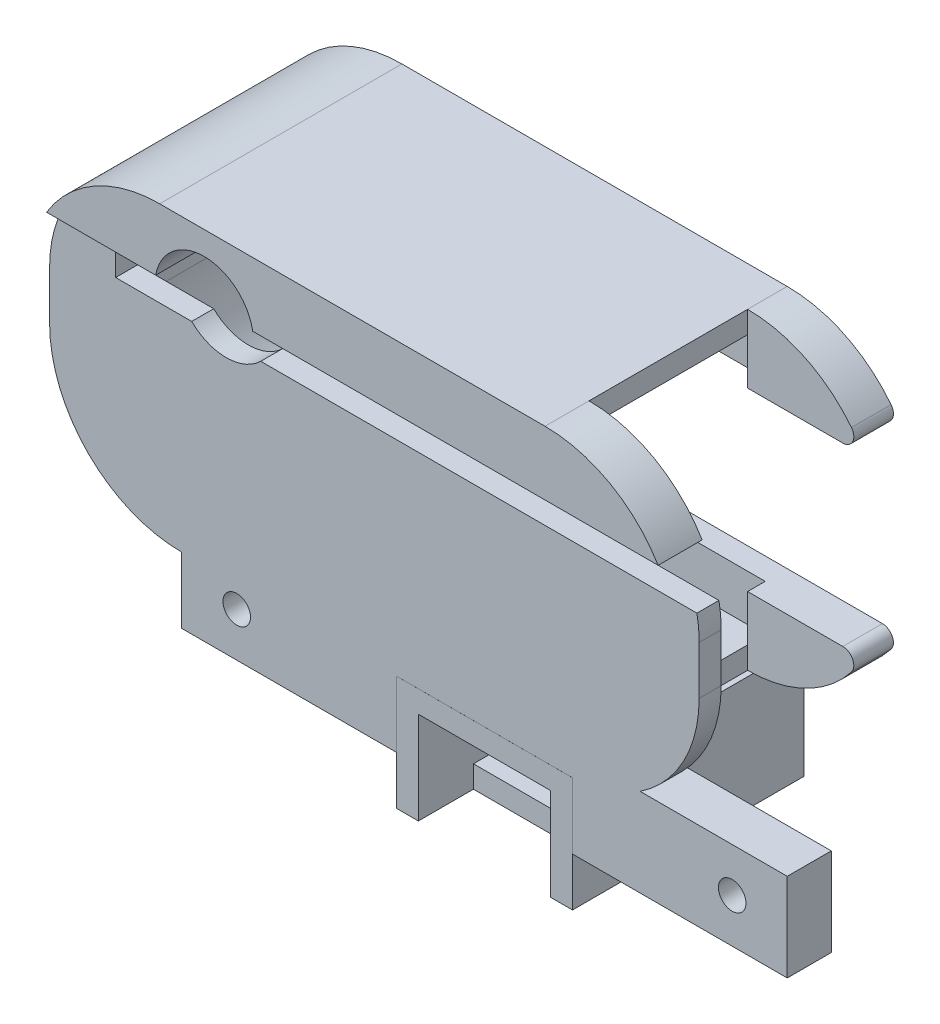
from build123d import *

# Parameters (mm, degrees)
BOSS_EXTRUDE1_OUTLINE_W  = 69.85
BOSS_EXTRUDE1_OUTLINE_H  = 10.16
BOSS_EXTRUDE1_DEPTH      = 5.08
SKETCH2_W                = 74.93
SKETCH2_H                = 36.068
BOSS_EXTRUDE2_DEPTH      = 25.4
FILLET1_R                = 15.24
SHELL5_START             = -17.78
SHELL5_DEPTH             = 20.32
SKETCH8_W                = 5.08
SKETCH8_H                = 20.32
CUT_EXTRUDE1_DEPTH       = 39.37
FILLET2_R                = 2.54
FILLET3_R                = 1.27
BOSS_EXTRUDE4_DEPTH      = 0.00254
BOSS_EXTRUDE4_DEPTH_BACK = 26.67
SKETCH4_W                = 20.32
SKETCH4_H                = 13.208
SKETCH9_R                = 3.175
CUT_EXTRUDE2_DEPTH       = 87.597276135
SKETCH10_R               = 5.690074484
CUT_EXTRUDE3_DEPTH       = 6.35
SKETCH11_R               = 1.5875
CUT_EXTRUDE4_DEPTH       = 7.62
SKETCH12_W               = 76.2
SKETCH12_H               = 5.08
CUT_EXTRUDE5_DEPTH       = 2.54
BOSS_EXTRUDE5_DEPTH      = 2.032
SKETCH14_W               = 15.24
SKETCH14_H               = 6.35
CUT_EXTRUDE6_DEPTH       = 2.54
SKETCH16_W               = 15.24
SKETCH16_H               = 8.128
CUT_EXTRUDE8_DEPTH       = 25.4
BOSS_EXTRUDE6_DEPTH      = 2.54


# Read off the part's stored shape, not the designer's step: Boss-Extrude1, Shell5
with BuildPart() as part:
    # Boss-Extrude1 outline → Boss-Extrude1 (new body)
    with BuildSketch(Plane.XY):
        with Locations((34.925, 5.08)):
            Rectangle(BOSS_EXTRUDE1_OUTLINE_W, BOSS_EXTRUDE1_OUTLINE_H)
    extrude(amount=BOSS_EXTRUDE1_DEPTH)

    # Sketch2 → Boss-Extrude2 (add)
    with BuildSketch(Plane.XY.offset(5.08)):
        with Locations((22.225, 25.654)):
            Rectangle(SKETCH2_W, SKETCH2_H)
    extrude(amount=-BOSS_EXTRUDE2_DEPTH)

    # Fillet1
    fillet1_edges = [part.edges().sort_by_distance(p)[0] for p in [
        (59.69, 7.62, -10.16),
        (59.69, 43.688, -7.62),
        (-15.24, 7.62, -7.62),
        (-15.24, 43.688, -7.62),
    ]]
    fillet(fillet1_edges, radius=FILLET1_R)

    # Shell5 outline → Shell5 (cut)
    with BuildSketch(Plane.XY.offset(SHELL5_START)):
        with BuildLine():
            ThreePointArc((-12.7, 22.86), (-8.980256121, 13.879743879), (0, 10.16))
            Line((0, 10.16), (44.45, 10.16))
            Line((44.45, 10.16), (44.45, 7.62))
            ThreePointArc((44.45, 7.62), (48.849409051, 8.268810878), (52.874226968, 10.16))
            ThreePointArc((52.874226968, 10.16), (57.878380747, 15.6533232), (59.69, 22.86))
            Line((59.69, 22.86), (59.69, 28.448))
            ThreePointArc((59.69, 28.448), (55.226307345, 39.224307345), (44.45, 43.688))
            Line((44.45, 43.688), (44.45, 41.148))
            Line((44.45, 41.148), (0, 41.148))
            ThreePointArc((0, 41.148), (-8.980256121, 37.428256121), (-12.7, 28.448))
            Line((-12.7, 28.448), (-12.7, 22.86))
        make_face()
    extrude(amount=SHELL5_DEPTH, mode=Mode.SUBTRACT)

    # Sketch8 → Cut-Extrude1 (cut)
    with BuildSketch(Plane(origin=(59.69, 0, 0), x_dir=(0, 0, -1), z_dir=(1, 0, 0))):
        with Locations((20.32, 25.654)):
            Rectangle(SKETCH8_W, SKETCH8_H)
    extrude(amount=-CUT_EXTRUDE1_DEPTH, mode=Mode.SUBTRACT)

    # Fillet2
    fillet2_edges = [part.edges().sort_by_distance(p)[0] for p in [
        (20.32, 15.494, -19.05),
        (20.32, 35.814, -19.05),
    ]]
    fillet(fillet2_edges, radius=FILLET2_R)

    # Fillet3
    fillet3_edges = [part.edges().sort_by_distance(p)[0] for p in [
        (57.791650722, 35.814, -19.05),
        (57.791650722, 15.494, -19.05),
    ]]
    fillet(fillet3_edges, radius=FILLET3_R)

    # Sketch4 → Boss-Extrude4 (add, two sides: drawn at the far end of the back side and taken through both)
    with BuildSketch(Plane.XY.offset(5.08).offset(-BOSS_EXTRUDE4_DEPTH_BACK)):
        with Locations((34.925, 1.016)):
            Rectangle(SKETCH4_W, SKETCH4_H)
    extrude(amount=BOSS_EXTRUDE4_DEPTH + BOSS_EXTRUDE4_DEPTH_BACK)

    # Sketch9 → Cut-Extrude2 (cut, through all)
    with BuildSketch(Plane.XY.offset(5.08254)):
        with Locations((34.925, 0.254)):
            Circle(SKETCH9_R)
    extrude(amount=-CUT_EXTRUDE2_DEPTH, mode=Mode.SUBTRACT)

    # Sketch10 → Cut-Extrude3 (cut)
    with BuildSketch(Plane.XY.offset(5.08)):
        with Locations((5.133620521, 35.306)):
            Circle(SKETCH10_R)
    extrude(amount=-CUT_EXTRUDE3_DEPTH, mode=Mode.SUBTRACT)

    # Sketch11 → Cut-Extrude4 (cut)
    with BuildSketch(Plane.XY.offset(5.08)):
        with Locations((6.35, 5.08)):
            Circle(SKETCH11_R)
        with Locations((63.5, 5.08)):
            Circle(SKETCH11_R)
    extrude(amount=-CUT_EXTRUDE4_DEPTH, mode=Mode.SUBTRACT)

    # Sketch12 → Cut-Extrude5 (cut)
    with BuildSketch(Plane.XY.offset(5.08)):
        with Locations((30.48, 33.782)):
            Rectangle(SKETCH12_W, SKETCH12_H)
    extrude(amount=-CUT_EXTRUDE5_DEPTH, mode=Mode.SUBTRACT)

    # Sketch13 → Boss-Extrude5 (add)
    with BuildSketch(Plane.XY.offset(-17.78)):
        with BuildLine():
            Line((44.45, 41.148), (44.45, 43.688))
            ThreePointArc((44.45, 43.688), (51.108835279, 42.156300869), (56.429175518, 37.869090909))
            ThreePointArc((56.429175518, 37.869090909), (56.573269297, 36.52909706), (55.430910891, 35.814))
            Line((55.430910891, 35.814), (44.45, 35.814))
            Line((44.45, 35.814), (44.45, 41.148))
        make_face()
        with BuildLine():
            Line((44.45, 7.62), (44.45, 15.494))
            Line((44.45, 15.494), (55.430910891, 15.494))
            ThreePointArc((55.430910891, 15.494), (56.573269297, 14.77890294), (56.429175518, 13.438909091))
            ThreePointArc((56.429175518, 13.438909091), (51.108835279, 9.151699131), (44.45, 7.62))
        make_face()
    extrude(amount=BOSS_EXTRUDE5_DEPTH)

    # Sketch14 → Cut-Extrude6 (cut)
    with BuildSketch(Plane.XZ.offset(5.588)):
        with Locations((34.925, 1.90754)):
            Rectangle(SKETCH14_W, SKETCH14_H)
    extrude(amount=-CUT_EXTRUDE6_DEPTH, mode=Mode.SUBTRACT)

    # Sketch16 → Cut-Extrude8 (cut)
    with BuildSketch(Plane.XY.offset(5.08254)):
        with Locations((34.925, 1.016)):
            Rectangle(SKETCH16_W, SKETCH16_H)
    extrude(amount=-CUT_EXTRUDE8_DEPTH, mode=Mode.SUBTRACT)

    # Sketch17 → Boss-Extrude6 (add)
    with BuildSketch(Plane.XY.offset(5.08)):
        with BuildLine():
            Line((44.45, 43.688), (0, 43.688))
            ThreePointArc((0, 43.688), (-7.491923652, 41.719348085), (-13.048284332, 36.322))
            Line((-13.048284332, 36.322), (-7.62, 36.322))
            Line((-7.62, 36.322), (-0.465012494, 36.322))
            ThreePointArc((-0.465012494, 36.322), (5.133620521, 40.996074484), (10.732253536, 36.322))
            Line((10.732253536, 36.322), (57.498284332, 36.322))
            ThreePointArc((57.498284332, 36.322), (51.941923652, 41.719348085), (44.45, 43.688))
        make_face()
    extrude(amount=BOSS_EXTRUDE6_DEPTH)


solid = part.part
